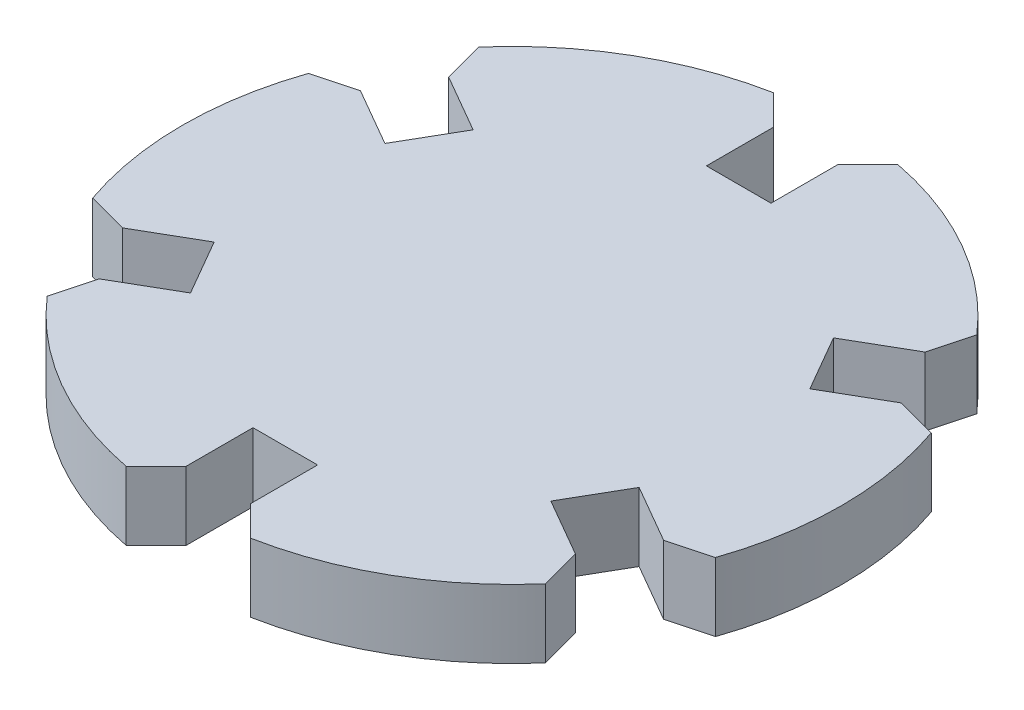
from build123d import *

# Parameters (mm, degrees)
SKETCH1_R           = 25
BOSS_EXTRUDE1_DEPTH = 5.2
SKETCH2_W           = 4.9
SKETCH2_H           = 7.8
CUT_EXTRUDE1_DEPTH  = 5.2
CHAMFER1_SIZE       = 2.6


with BuildPart() as part:
    # Sketch1 → Boss-Extrude1 (new body)
    with BuildSketch(Plane(origin=(0, 0, 0), x_dir=(1, 0, 0), z_dir=(0, 1, 0))):
        with Locations(Location((0, 0, 0), (0, 0, 270))):
            Circle(SKETCH1_R)
    extrude(amount=BOSS_EXTRUDE1_DEPTH)

    # Sketch2 → Cut-Extrude1 (cut)
    with BuildSketch(Plane(origin=(0, 5.2, 0), x_dir=(1, 0, 0), z_dir=(0, 1, 0))):
        Polygon((22.875635095, 10.378237761), (16.120636945, 6.478237761), (13.670636945, 10.721762239), (20.425635095, 14.621762239), align=None)
        with Locations((0, 21.1)):
            Rectangle(SKETCH2_W, SKETCH2_H)
        Polygon((20.425635095, -14.621762239), (13.670636945, -10.721762239), (16.120636945, -6.478237761), (22.875635095, -10.378237761), align=None)
        with Locations((0, -21.1)):
            Rectangle(SKETCH2_W, SKETCH2_H)
        Polygon((-22.875635095, -10.378237761), (-16.120636945, -6.478237761), (-13.670636945, -10.721762239), (-20.425635095, -14.621762239), align=None)
        Polygon((-20.425635095, 14.621762239), (-13.670636945, 10.721762239), (-16.120636945, 6.478237761), (-22.875635095, 10.378237761), align=None)
    extrude(amount=-CUT_EXTRUDE1_DEPTH, mode=Mode.SUBTRACT)

    # Chamfer1
    # the kernel refuses this chamfer: 2.6, 2.378368378 mm, written as the material it takes off along each edge
    with BuildSketch(Plane(origin=(20.321417916, 11.886375769, -14.561592423), x_dir=(-0.6191501526996462, 0, -0.7852726204395546), z_dir=(0, -1, 0)), Plane(origin=(-2.45, 11.886375769, -24.879660367), x_dir=(-0.9896411145468598, 0, 0.14356345077508154), z_dir=(0, -1, 0)), Plane(origin=(-22.771417916, 11.886375769, -10.318067944), x_dir=(-0.37049096184717384, 0, 0.9288360712146981), z_dir=(0, -1, 0)), Plane(origin=(-20.321417916, 11.886375769, 14.561592423), x_dir=(0.6191501526997778, 0, 0.785272620439451), z_dir=(0, -1, 0)), Plane(origin=(2.45, 11.886375769, 24.879660367), x_dir=(0.9896411145468216, 0, -0.14356345077534402), z_dir=(0, -1, 0)), Plane(origin=(22.771417916, 11.886375769, 10.318067944), x_dir=(0.3704909618470835, 0, -0.9288360712147342), z_dir=(0, -1, 0))) as chamfer1_piece_1:
        with BuildLine():
            Line((2.294378332, 0), (CHAMFER1_SIZE * 0.143563450775, -CHAMFER1_SIZE * 0.989641114547))
            Line((CHAMFER1_SIZE * 0.143563450775, -CHAMFER1_SIZE * 0.989641114547), (0, 0))
            ThreePointArc((0, 0), (1.178279971, 0.026315397), (2.294378332, 0))
        make_face()
    extrude(amount=18.572751537, mode=Mode.SUBTRACT)
    with BuildSketch(Plane(origin=(22.771417916, 11.886375769, -10.318067944), x_dir=(-0.8660254037844386, 0, 0.49999999999999983), z_dir=(0, -1, 0)), Plane(origin=(2.45, 11.886375769, -24.879660367), x_dir=(0, 0, 1), z_dir=(0, -1, 0)), Plane(origin=(-20.321417916, 11.886375769, -14.561592423), x_dir=(0.8660254037844397, 0, 0.4999999999999983), z_dir=(0, -1, 0)), Plane(origin=(-22.771417916, 11.886375769, 10.318067944), x_dir=(0.8660254037844377, 0, -0.5000000000000014), z_dir=(0, -1, 0)), Plane(origin=(-2.45, 11.886375769, 24.879660367), x_dir=(0, 0, -1), z_dir=(0, -1, 0))) as chamfer1_piece_2:
        with BuildLine():
            Line((CHAMFER1_SIZE, 0), (0.329388871, -2.270611129))
            ThreePointArc((0.329388871, -2.270611129), (0.14311514, -1.169852233), (0, 0))
            Line((0, 0), (CHAMFER1_SIZE, 0))
        make_face()
    extrude(amount=18.572751537, mode=Mode.SUBTRACT)
    with BuildSketch(Plane(origin=(20.321417916, 11.886375769, 14.561592423), x_dir=(-0.6191501526994649, 0, 0.7852726204396976), z_dir=(0, -1, 0))) as chamfer1_piece_3:
        with BuildLine():
            Line((2.294378332, 0), (CHAMFER1_SIZE * 0.143563450775, CHAMFER1_SIZE * 0.989641114547))
            Line((CHAMFER1_SIZE * 0.143563450775, CHAMFER1_SIZE * 0.989641114547), (0, 0))
            ThreePointArc((0, 0), (1.178279971, -0.026315397), (2.294378332, 0))
        make_face()
    extrude(amount=18.572751537, mode=Mode.SUBTRACT)


solid = part.part
